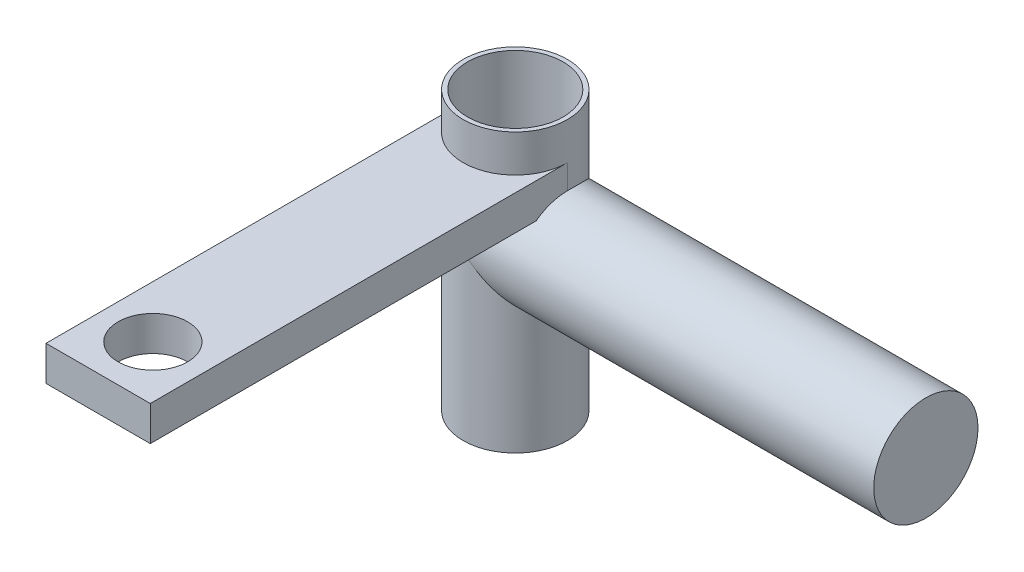
from build123d import *

# Parameters (mm, degrees)
SKETCH1_R          = 9.525
SLEEVE_DEPTH       = 50.8
SKETCH2_W          = 19.05
SKETCH2_H          = 6.35
BRACKET_DEPTH      = 76.2
SKETCH4_R          = 6.35
BRACKET_HOLE_DEPTH = 93.075
SKETCH5_R          = 9.525
SHAFT_DEPTH        = 75
SKETCH6_R          = 8.73125
SLEEVE_HOLE_DEPTH  = 119.372631972


with BuildPart() as part:
    # Sketch1 → Sleeve (new body)
    with BuildSketch(Plane(origin=(0, 0, 0), x_dir=(1, 0, 0), z_dir=(0, 1, 0))):
        Circle(SKETCH1_R)
    extrude(amount=SLEEVE_DEPTH)

    # Sketch2 → Bracket (add)
    with BuildSketch(Plane.XY):
        with Locations((0, 40.8)):
            Rectangle(SKETCH2_W, SKETCH2_H)
    extrude(amount=BRACKET_DEPTH)

    # Sketch4 → Bracket Hole (cut, through all)
    with BuildSketch(Plane(origin=(0, 0, 0), x_dir=(1, 0, 0), z_dir=(0, 1, 0))):
        with Locations((0, -66.2)):
            Circle(SKETCH4_R)
    extrude(amount=BRACKET_HOLE_DEPTH, mode=Mode.SUBTRACT)

    # Sketch5 → Shaft (add)
    with BuildSketch(Plane(origin=(0, 0, 0), x_dir=(0, 0, -1), z_dir=(1, 0, 0))):
        with Locations((0, 30)):
            Circle(SKETCH5_R)
    extrude(amount=SHAFT_DEPTH)

    # Sketch6 → Sleeve Hole (cut, through all)
    with BuildSketch(Plane(origin=(0, 0, 0), x_dir=(1, 0, 0), z_dir=(0, 1, 0))):
        Circle(SKETCH6_R)
    extrude(amount=SLEEVE_HOLE_DEPTH, mode=Mode.SUBTRACT)


solid = part.part
